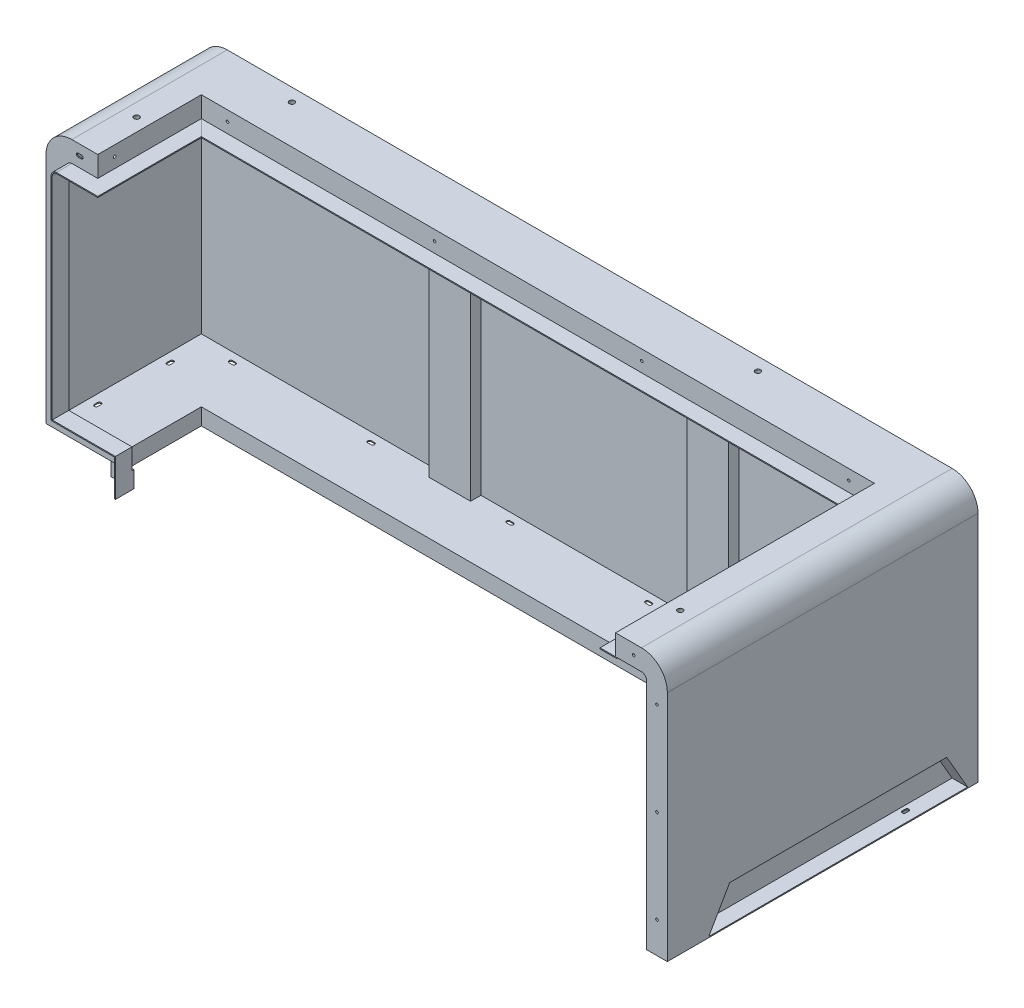
from build123d import *

# Parameters (mm, degrees)
SKETCH_1_W                   = 1500
SKETCH_1_H                   = 300
EXTRUDE_1_DEPTH              = 500
FILLET_1_R                   = 50
CUT_EXTRUDE_1_REACH          = 915.783
CUT_EXTRUDE_2_DEPTH          = 260
SKETCH_6_W                   = 1300
SKETCH_6_H                   = 60
CUT_EXTRUDE_3_DEPTH          = 460
SKETCH_9_W                   = 32
SKETCH_9_H                   = 2
SHELL_START                  = -148
SHELL_1_DEPTH                = 96
SHELL_START_2                = -52
SHELL_1_2_DEPTH              = 100
SHELL_START_3                = 48
SHELL_1_3_DEPTH              = 100
CUT_EXTRUDE_4_DEPTH          = 30
EXTRUDE_START                = -2
SKETCH_17_W                  = 84
SKETCH_17_H                  = 30
EXTRUDE_2_DEPTH              = 2
EXTRUDE_3_DEPTH              = 2
SKETCH_19_W                  = 2
SKETCH_19_H                  = 72
EXTRUDE_4_DEPTH              = 38
SKETCH_20_W                  = 38
SKETCH_20_H                  = 32
EXTRUDE_5_DEPTH              = 4
SKETCH_21_W                  = 40
SKETCH_21_H                  = 30
CUT_EXTRUDE_5_DEPTH          = 4
EXTRUDE_START_2              = 30
EXTRUDE_6_DEPTH              = 30
EXTRUDE_7_DEPTH              = 2
SKETCH_24_W                  = 4
SKETCH_24_H                  = 32
CUT_EXTRUDE_6_DEPTH          = 32
EXTRUDE_8_DEPTH              = 30
MOVE_START                   = 20
MOVE_FACE_1_DEPTH            = 30
MOVE_START_2                 = 50
MOVE_FACE_1_2_DEPTH          = 400
MOVE_START_3                 = 448
MOVE_FACE_1_3_DEPTH          = 2
MOVE_START_4                 = 420
MOVE_FACE_1_4_DEPTH          = 28
MOVE_START_5                 = 18
MOVE_FACE_1_5_DEPTH          = 400
CUT_EXTRUDE_7_REACH          = 1645.928
EXTRUDE_9_DEPTH              = 30
EXTRUDE_10_DEPTH             = 2
EXTRUDE_11_DEPTH             = 30
EXTRUDE_START_3              = -280
EXTRUDE_12_DEPTH             = 50
SHELL_2_T                    = -2
SKETCH_32_W                  = 2.5
SKETCH_32_H                  = 405
HOLE_WIZARD_M6_1_AT_2_COUNT  = 2
HOLE_WIZARD_M6_1_AT_2_PITCH  = 40
SKETCH_33_R                  = 2.5
EXTRUDE_13_DEPTH             = 4.25
CUT_EXTRUDE_8_DEPTH          = 2
HOLE_WIZARD_M12_1_AT_2_COUNT = 2
HOLE_WIZARD_M12_1_AT_2_PITCH = 900
HOLE_WIZARD_M12_1_AT_3_COUNT = 2
HOLE_WIZARD_M12_1_AT_3_PITCH = 1313.868334347
HOLE_WIZARD_M12_1_AT_4_COUNT = 2
HOLE_WIZARD_M12_1_AT_4_PITCH = 215.058131676
SKETCH_41_W                  = 40
SKETCH_41_H                  = 40
SKETCH_41_R                  = 5.1
EXTRUDE_14_DEPTH             = 10
EXTRUDE_14_2_DEPTH           = 10
EXTRUDE_14_3_DEPTH           = 10
EXTRUDE_14_4_DEPTH           = 10
HOLE_WIZARD_M6_1_2_DEPTH     = 2
HOLE_WIZARD_M6_2_DEPTH       = 2
HOLE_WIZARD_M6_3_AT_2_COUNT  = 2
HOLE_WIZARD_M6_3_AT_2_PITCH  = 75
HOLE_WIZARD_M6_3_AT_3_COUNT  = 2
HOLE_WIZARD_M6_3_AT_3_PITCH  = 244.182308941
HOLE_WIZARD_M6_3_AT_4_COUNT  = 2
HOLE_WIZARD_M6_3_AT_4_PITCH  = 422.40383521
SKETCH_49_R                  = 2.5
EXTRUDE_15_DEPTH             = 4.25
CUT_EXTRUDE_9_DEPTH          = 4.25
HOLE_WIZARD_M6_6_AT_2_COUNT  = 2
HOLE_WIZARD_M6_6_AT_2_PITCH  = 400
HOLE_WIZARD_M6_6_AT_3_COUNT  = 2
HOLE_WIZARD_M6_6_AT_3_PITCH  = 800
HOLE_WIZARD_M6_6_AT_4_COUNT  = 2
HOLE_WIZARD_M6_6_AT_4_PITCH  = 1200
SKETCH_57_R                  = 2.5
EXTRUDE_16_DEPTH             = 4.25
SKETCH_58_R                  = 2.5
EXTRUDE_17_DEPTH             = 4.25
SKETCH_59_R                  = 2.5
EXTRUDE_18_DEPTH             = 4.25


# Read off the part's stored shape, not the designer's step: 抽壳1, 移动面1, M6 间隙槽口1, M6 间隙槽口2
with BuildPart() as part:
    # 草图1 → 凸台-拉伸1 (new body)
    with BuildSketch(Plane(origin=(0, 0, 0), x_dir=(1, 0, 0), z_dir=(0, 1, 0))):
        Rectangle(SKETCH_1_W, SKETCH_1_H)
    extrude(amount=EXTRUDE_1_DEPTH)

    # 圆角1
    fillet_1_edges = [part.edges().sort_by_distance(p)[0] for p in [
        (-750, 500, 0),
        (750, 500, 0),
    ]]
    fillet(fillet_1_edges, radius=FILLET_1_R)

    # 切除-拉伸1: up to this face of the body (flat: up to its plane)
    cut_extrude_1_end = Plane(part.part.faces().sort_by_distance((0, 0, 0))[0])
    # 草图3 → 切除-拉伸1 (cut, up to the picked face)
    with BuildSketch(Plane(origin=(0, 500, 0), x_dir=(1, 0, 0), z_dir=(0, 1, 0)), mode=Mode.PRIVATE) as cut_extrude_1_sk1:
        Polygon((-650, -150), (-650, 50), (650, 50), (650, -50), (750, -50), (750, -150), align=None)
    cut_extrude_1_tool1 = split(extrude(cut_extrude_1_sk1.sketch, amount=-CUT_EXTRUDE_1_REACH, mode=Mode.PRIVATE), bisect_by=cut_extrude_1_end, keep=Keep.BOTH, mode=Mode.PRIVATE)
    add(cut_extrude_1_tool1.solids().sort_by(Axis((25.925926, 500, 51.851852), (0, -1, 0)))[0], mode=Mode.SUBTRACT)

    # 草图5 → 切除-拉伸2 (cut)
    with BuildSketch(Plane.XY.offset(150)):
        with BuildLine():
            Line((-650, 0), (-650, 460))
            Line((-650, 460), (-700, 460))
            ThreePointArc((-700, 460), (-707.071067812, 457.071067812), (-710, 450))
            Line((-710, 450), (-710, 0))
            Line((-710, 0), (-650, 0))
        make_face()
        with BuildLine():
            Line((650, 460), (650, 0))
            Line((650, 0), (710, 0))
            Line((710, 0), (710, 450))
            ThreePointArc((710, 450), (707.071067812, 457.071067812), (700, 460))
            Line((700, 460), (650, 460))
        make_face()
    extrude(amount=-CUT_EXTRUDE_2_DEPTH, mode=Mode.SUBTRACT)

    # 草图6 → 切除-拉伸3 (cut)
    with BuildSketch(Plane.XZ):
        with Locations((0, -80)):
            Rectangle(SKETCH_6_W, SKETCH_6_H)
    extrude(amount=-CUT_EXTRUDE_3_DEPTH, mode=Mode.SUBTRACT)

    # 扫描1: sweep along a path in 草图8
    with BuildLine(Plane.XZ) as sweep_1_path:
        Line((-710, 150), (-710, -110))
        Line((-710, -110), (710, -110))
        Line((710, -110), (710, 50))
    # 草图7 → 扫描1 (sweep)
    with BuildSketch(Plane.XY.offset(50)):
        Polygon((710, 0), (708, 0), (708, -30), (706, -30), (706, 2), (710, 2), align=None)
    sweep(path=sweep_1_path.line, transition=Transition.RIGHT)

    # 扫描2: sweep along a path in 草图10
    with BuildLine(Plane.XZ.offset(-460)) as sweep_2_path:
        Line((-650, 150), (-650, -50))
        Line((-650, -50), (650, -50))
        Line((650, -50), (650, 50))
    # 草图9 → 扫描2 (sweep)
    with BuildSketch(Plane.XY.offset(50)):
        with Locations((636, 459)):
            Rectangle(SKETCH_9_W, SKETCH_9_H)
    sweep(path=sweep_2_path.line, transition=Transition.RIGHT)

    # 抽壳1 outline → 抽壳1 (cut)
    with BuildSketch(Plane.XY.offset(SHELL_START)):
        with BuildLine():
            Line((748, 2), (748, 450))
            ThreePointArc((748, 450), (733.941125497, 483.941125497), (700, 498))
            Line((700, 498), (-700, 498))
            ThreePointArc((-700, 498), (-733.941125497, 483.941125497), (-748, 450))
            Line((-748, 450), (-748, 2))
            Line((-748, 2), (748, 2))
        make_face()
    extrude(amount=SHELL_1_DEPTH, mode=Mode.SUBTRACT)

    # Shell 1 2 outline → Shell 1 2 (cut)
    with BuildSketch(Plane.XY.offset(SHELL_START_2)):
        with BuildLine():
            Line((710, 2), (748, 2))
            Line((748, 2), (748, 450))
            ThreePointArc((748, 450), (733.941125497, 483.941125497), (700, 498))
            Line((700, 498), (652, 498))
            Line((652, 498), (652, 460))
            Line((652, 460), (700, 460))
            ThreePointArc((700, 460), (707.071067812, 457.071067812), (710, 450))
            Line((710, 450), (710, 2))
        make_face()
        with BuildLine():
            Line((-748, 2), (-710, 2))
            Line((-710, 2), (-710, 450))
            ThreePointArc((-710, 450), (-707.071067812, 457.071067812), (-700, 460))
            Line((-700, 460), (-652, 460))
            Line((-652, 460), (-652, 498))
            Line((-652, 498), (-700, 498))
            ThreePointArc((-700, 498), (-733.941125497, 483.941125497), (-748, 450))
            Line((-748, 450), (-748, 2))
        make_face()
    extrude(amount=SHELL_1_2_DEPTH, mode=Mode.SUBTRACT)

    # Shell 1 3 outline → Shell 1 3 (cut)
    with BuildSketch(Plane.XY.offset(SHELL_START_3)):
        with BuildLine():
            Line((-748, 2), (-710, 2))
            Line((-710, 2), (-710, 450))
            ThreePointArc((-710, 450), (-707.071067812, 457.071067812), (-700, 460))
            Line((-700, 460), (-652, 460))
            Line((-652, 460), (-652, 498))
            Line((-652, 498), (-700, 498))
            ThreePointArc((-700, 498), (-733.941125497, 483.941125497), (-748, 450))
            Line((-748, 450), (-748, 2))
        make_face()
    extrude(amount=SHELL_1_3_DEPTH, mode=Mode.SUBTRACT)

    # 扫描3: sweep along a path in 草图14
    with BuildLine(Plane(origin=(0, 2, 0), x_dir=(1, 0, 0), z_dir=(0, 1, 0))) as sweep_3_path:
        Line((550, 106), (-706, 106))
        Line((-706, 106), (-706, -150))
    # 草图12 → 扫描3 (sweep)
    with BuildSketch(Plane.XY.offset(150)):
        Polygon((-706, 0), (-628, 0), (-628, -30), (-626, -30), (-626, 2), (-706, 2), align=None)
    sweep(path=sweep_3_path.line, transition=Transition.RIGHT)

    # 草图15 → 切除-拉伸4 (cut)
    with BuildSketch(Plane.XZ.offset(30)):
        Polygon((-750, 150), (-750, -150), (750, -150), (750, -28), (-628, -28), (-628, 150), align=None)
    extrude(amount=-CUT_EXTRUDE_4_DEPTH, mode=Mode.SUBTRACT)

    # 草图17 → 凸台-拉伸2 (add)
    with BuildSketch(Plane.XY.offset(150).offset(EXTRUDE_START)):
        with Locations((-668, 17)):
            Rectangle(SKETCH_17_W, SKETCH_17_H)
    extrude(amount=EXTRUDE_2_DEPTH)

    # 草图18 → 凸台-拉伸3 (add)
    with BuildSketch(Plane.XY.offset(150)):
        with BuildLine():
            Line((-700, 500), (-650, 500))
            Line((-650, 500), (-650, 458))
            Line((-650, 458), (-700, 458))
            ThreePointArc((-700, 458), (-705.656854249, 455.656854249), (-708, 450))
            Line((-708, 450), (-708, 42))
            Line((-708, 42), (-626, 42))
            Line((-626, 42), (-626, 0))
            Line((-626, 0), (-750, 0))
            Line((-750, 0), (-750, 450))
            ThreePointArc((-750, 450), (-735.355339059, 485.355339059), (-700, 500))
        make_face()
    extrude(amount=-EXTRUDE_3_DEPTH)

    # 草图19 → 凸台-拉伸4 (add)
    with BuildSketch(Plane(origin=(-626, 0, 0), x_dir=(0, 0, -1), z_dir=(1, 0, 0))):
        with Locations((-149, 6)):
            Rectangle(SKETCH_19_W, SKETCH_19_H)
    extrude(amount=EXTRUDE_4_DEPTH)

    # 草图20 → 凸台-拉伸5 (add)
    with BuildSketch(Plane(origin=(0, 0, 148), x_dir=(-1, 0, 0), z_dir=(0, 0, -1))):
        with Locations((607, -14)):
            Rectangle(SKETCH_20_W, SKETCH_20_H)
    extrude(amount=EXTRUDE_5_DEPTH)

    # 草图21 → 切除-拉伸5 (cut)
    with BuildSketch(Plane.XY.offset(150)):
        with Locations((-608, -15)):
            Rectangle(SKETCH_21_W, SKETCH_21_H)
    extrude(amount=-CUT_EXTRUDE_5_DEPTH, mode=Mode.SUBTRACT)

    # 草图22 → 凸台-拉伸6 (add)
    with BuildSketch(Plane.XY.offset(150).offset(EXTRUDE_START_2)):
        with BuildLine():
            Line((-588, 42), (-708, 42))
            Line((-708, 42), (-708, 450))
            ThreePointArc((-708, 450), (-705.656854249, 455.656854249), (-700, 458))
            Line((-700, 458), (-620, 458))
            Line((-620, 458), (-620, 460))
            Line((-620, 460), (-700, 460))
            ThreePointArc((-700, 460), (-707.071067812, 457.071067812), (-710, 450))
            Line((-710, 450), (-710, 40))
            Line((-710, 40), (-588, 40))
            Line((-588, 40), (-588, 42))
        make_face()
    extrude(amount=-EXTRUDE_6_DEPTH)

    # 草图23 → 凸台-拉伸7 (add)
    with BuildSketch(Plane(origin=(-588, 0, 0), x_dir=(0, 0, -1), z_dir=(1, 0, 0))):
        Polygon((-180, 42), (-180, -30), (-144, -30), (-144, 2), (-148, 2), (-148, 42), align=None)
    extrude(amount=EXTRUDE_7_DEPTH)

    # 草图24 → 切除-拉伸6 (cut)
    with BuildSketch(Plane.XY.offset(50)):
        with Locations((708, -14)):
            Rectangle(SKETCH_24_W, SKETCH_24_H)
    extrude(amount=-CUT_EXTRUDE_6_DEPTH, mode=Mode.SUBTRACT)

    # 草图25 → 凸台-拉伸8 (add)
    with BuildSketch(Plane.XY.offset(50)):
        with BuildLine():
            Line((710, 450), (710, 0))
            Line((710, 0), (712, 0))
            Line((712, 0), (712, 450))
            ThreePointArc((712, 450), (708.485281374, 458.485281374), (700, 462))
            Line((700, 462), (652, 462))
            Line((652, 462), (652, 460))
            Line((652, 460), (700, 460))
            ThreePointArc((700, 460), (707.071067812, 457.071067812), (710, 450))
        make_face()
    extrude(amount=-EXTRUDE_8_DEPTH)

    # Move Face 1 outline → Move Face 1 (cut)
    with BuildSketch(Plane.XY.offset(MOVE_START)):
        with BuildLine():
            Line((710, 450), (710, 2))
            Line((710, 2), (748, 2))
            Line((748, 2), (748, 450))
            ThreePointArc((748, 450), (733.941125497, 483.941125497), (700, 498))
            Line((700, 498), (652, 498))
            Line((652, 498), (652, 460))
            Line((652, 460), (700, 460))
            ThreePointArc((700, 460), (707.071067812, 457.071067812), (710, 450))
        make_face()
    extrude(amount=MOVE_FACE_1_DEPTH, mode=Mode.SUBTRACT)

    # Move Face 1 2 outline → Move Face 1 2 (add)
    with BuildSketch(Plane.XY.offset(MOVE_START_2)):
        with BuildLine():
            Line((710, 2), (710, 0))
            Line((710, 0), (750, 0))
            Line((750, 0), (750, 450))
            ThreePointArc((750, 450), (735.355339059, 485.355339059), (700, 500))
            Line((700, 500), (650, 500))
            Line((650, 500), (650, 460))
            Line((650, 460), (620, 460))
            Line((620, 460), (620, 458))
            Line((620, 458), (652, 458))
            Line((652, 458), (652, 498))
            Line((652, 498), (700, 498))
            ThreePointArc((700, 498), (733.941125497, 483.941125497), (748, 450))
            Line((748, 450), (748, 2))
            Line((748, 2), (710, 2))
        make_face()
    extrude(amount=MOVE_FACE_1_2_DEPTH)

    # Move Face 1 3 outline → Move Face 1 3 (add)
    with BuildSketch(Plane.XY.offset(MOVE_START_3)):
        with BuildLine():
            Line((710, 450), (710, 2))
            Line((710, 2), (748, 2))
            Line((748, 2), (748, 450))
            ThreePointArc((748, 450), (733.941125497, 483.941125497), (700, 498))
            Line((700, 498), (652, 498))
            Line((652, 498), (652, 460))
            Line((652, 460), (700, 460))
            ThreePointArc((700, 460), (707.071067812, 457.071067812), (710, 450))
        make_face()
    extrude(amount=MOVE_FACE_1_3_DEPTH)

    # Move Face 1 4 outline → Move Face 1 4 (add)
    with BuildSketch(Plane.XY.offset(MOVE_START_4)):
        with BuildLine():
            Line((710, 450), (710, 2))
            Line((710, 2), (712, 2))
            Line((712, 2), (712, 450))
            ThreePointArc((712, 450), (708.485281374, 458.485281374), (700, 462))
            Line((700, 462), (652, 462))
            Line((652, 462), (652, 460))
            Line((652, 460), (700, 460))
            ThreePointArc((700, 460), (707.071067812, 457.071067812), (710, 450))
        make_face()
    extrude(amount=MOVE_FACE_1_4_DEPTH)

    # Move Face 1 5 outline → Move Face 1 5 (add)
    with BuildSketch(Plane.XY.offset(MOVE_START_5)):
        Polygon((706, -30), (708, -30), (708, 0), (710, 0), (710, 2), (706, 2), align=None)
    extrude(amount=MOVE_FACE_1_5_DEPTH)

    # 草图26 → 切除-拉伸7 (cut, up to next)
    with BuildSketch(Plane(origin=(750, 0, 0), x_dir=(0, 0, -1), z_dir=(1, 0, 0)), mode=Mode.PRIVATE) as cut_extrude_7_sk1:
        Polygon((-370, 2), (130, 2), (89.585481157, 72), (-329.585481157, 72), align=None)
    cut_extrude_7_tool1 = extrude(cut_extrude_7_sk1.sketch, amount=-CUT_EXTRUDE_7_REACH, mode=Mode.PRIVATE) & part.part
    add(cut_extrude_7_tool1.solids().sort_by_distance((750, 35.97407, 120))[0], mode=Mode.SUBTRACT)

    # 草图27 → 凸台-拉伸9 (add)
    with BuildSketch(Plane(origin=(750, 0, 0), x_dir=(0, 0, -1), z_dir=(1, 0, 0))):
        Polygon((130, 2), (89.585481157, 72), (-329.585481157, 72), (-370, 2), (-372.309401077, 2), (-330.740181695, 74), (90.740181695, 74), (132.309401077, 2), align=None)
    extrude(amount=-EXTRUDE_9_DEPTH)

    # 草图28 → 凸台-拉伸10 (add)
    with BuildSketch(Plane.ZY.offset(-720)):
        Polygon((330.740181695, 74), (372.309401077, 2), (-132.309401077, 2), (-90.740181695, 74), align=None)
    extrude(amount=EXTRUDE_10_DEPTH)

    # 草图29 → 凸台-拉伸11 (add)
    with BuildSketch(Plane.XZ):
        Polygon((550, -26), (550, -106), (706, -106), (706, -28), (708, -28), (708, -108), (548, -108), (548, -26), align=None)
    extrude(amount=EXTRUDE_11_DEPTH)

    # 草图34 → 切除-拉伸8 (cut)
    with BuildSketch(Plane(origin=(0, 74, 0), x_dir=(1, 0, 0), z_dir=(0, 1, 0))):
        with BuildLine():
            Line((738.5, -239), (738.5, -251))
            ThreePointArc((738.5, -251), (735, -254.5), (731.5, -251))
            Line((731.5, -251), (731.5, -239))
            ThreePointArc((731.5, -239), (735, -235.5), (738.5, -239))
        make_face()
        with BuildLine():
            Line((738.5, -1), (738.5, 11))
            ThreePointArc((738.5, 11), (735, 14.5), (731.5, 11))
            Line((731.5, 11), (731.5, -1))
            ThreePointArc((731.5, -1), (735, -4.5), (738.5, -1))
        make_face()
    extrude(amount=-CUT_EXTRUDE_8_DEPTH, mode=Mode.SUBTRACT)

    # 扫描4: sweep along a path in 草图36
    with BuildLine(Plane(origin=(0, 0, 448), x_dir=(-1, 0, 0), z_dir=(0, 0, -1))) as sweep_4_path:
        Line((-652, 498), (-700, 498))
        ThreePointArc((-700, 498), (-733.941125497, 483.941125497), (-748, 450))
        Line((-748, 450), (-748, 74))
    # 草图35 → 扫描4 (sweep)
    with BuildSketch(Plane(origin=(0, 74, 0), x_dir=(1, 0, 0), z_dir=(0, 1, 0))):
        Polygon((748, -20), (728, -20), (728, -100), (748, -100), (748, -98), (730, -98), (730, -22), (748, -22), align=None)
    sweep(path=sweep_4_path.line)

    # 扫描5: sweep along a path in 草图38
    with BuildLine(Plane(origin=(-748, 0, 0), x_dir=(0, 0, -1), z_dir=(1, 0, 0))) as sweep_5_path:
        Line((148, 2), (148, 498))
        Line((148, 498), (52, 498))
    # 草图37 → 扫描5 (sweep)
    with BuildSketch(Plane(origin=(0, 2, 0), x_dir=(1, 0, 0), z_dir=(0, 1, 0))):
        Polygon((210, 148), (210, 128), (290, 128), (290, 148), (288, 148), (288, 130), (212, 130), (212, 148), align=None)
        Polygon((-288, 148), (-288, 128), (-208, 128), (-208, 148), (-210, 148), (-210, 130), (-286, 130), (-286, 148), align=None)
    sweep(path=sweep_5_path.line, transition=Transition.RIGHT)

    # 草图40 → M12 螺纹孔1 (revolve, cut)
    with BuildSketch(Plane(origin=(-550, 500, -125), x_dir=(0, 0, 1), z_dir=(1, 0, 0))):
        Polygon((0, 0), (0, 32.314389157), (5.1, 29.25), (5.1, 0), align=None)
    hole_wizard_m12_1 = revolve(axis=Axis((-550, 506.35, -125), (0, -1, 0)), mode=Mode.SUBTRACT)

    # M12 螺纹孔1 at 2: M12 螺纹孔1 ×2
    with Locations(*[(i * HOLE_WIZARD_M12_1_AT_2_PITCH, 0, 0) for i in range(1, HOLE_WIZARD_M12_1_AT_2_COUNT)]):
        add(hole_wizard_m12_1, mode=Mode.SUBTRACT)

    # M12 螺纹孔1 at 3: M12 螺纹孔1 ×2
    with Locations(*[Vector(0.9323613089501445, 0, 0.36152785449087244) * (i * HOLE_WIZARD_M12_1_AT_3_PITCH) for i in range(1, HOLE_WIZARD_M12_1_AT_3_COUNT)]):
        add(hole_wizard_m12_1, mode=Mode.SUBTRACT)

    # M12 螺纹孔1 at 4: M12 螺纹孔1 ×2
    with Locations(*[Vector(-0.5812381937190964, 0, 0.8137334712067351) * (i * HOLE_WIZARD_M12_1_AT_4_PITCH) for i in range(1, HOLE_WIZARD_M12_1_AT_4_COUNT)]):
        add(hole_wizard_m12_1, mode=Mode.SUBTRACT)

    # Hole Wizard M6 _1 2 outline → Hole Wizard M6 _1 2 (cut)
    with BuildSketch(Plane(origin=(0, 0, 0), x_dir=(1, 0, 0), z_dir=(0, 1, 0))):
        with BuildLine():
            ThreePointArc((-667, 126.5), (-663.5, 130), (-667, 133.5))
            Line((-667, 133.5), (-673, 133.5))
            ThreePointArc((-673, 133.5), (-676.5, 130), (-673, 126.5))
            Line((-673, 126.5), (-667, 126.5))
        make_face()
        with BuildLine():
            ThreePointArc((-405, 133.5), (-408.5, 130), (-405, 126.5))
            Line((-405, 126.5), (-399, 126.5))
            ThreePointArc((-399, 126.5), (-395.5, 130), (-399, 133.5))
            Line((-399, 133.5), (-405, 133.5))
        make_face()
        with BuildLine():
            ThreePointArc((-137, 133.5), (-140.5, 130), (-137, 126.5))
            Line((-137, 126.5), (-131, 126.5))
            ThreePointArc((-131, 126.5), (-127.5, 130), (-131, 133.5))
            Line((-131, 133.5), (-137, 133.5))
        make_face()
        with BuildLine():
            ThreePointArc((131, 133.5), (127.5, 130), (131, 126.5))
            Line((131, 126.5), (137, 126.5))
            ThreePointArc((137, 126.5), (140.5, 130), (137, 133.5))
            Line((137, 133.5), (131, 133.5))
        make_face()
        with BuildLine():
            ThreePointArc((399, 133.5), (395.5, 130), (399, 126.5))
            Line((399, 126.5), (405, 126.5))
            ThreePointArc((405, 126.5), (408.5, 130), (405, 133.5))
            Line((405, 133.5), (399, 133.5))
        make_face()
        with BuildLine():
            ThreePointArc((667, 133.5), (663.5, 130), (667, 126.5))
            Line((667, 126.5), (673, 126.5))
            ThreePointArc((673, 126.5), (676.5, 130), (673, 133.5))
            Line((673, 133.5), (667, 133.5))
        make_face()
    extrude(amount=HOLE_WIZARD_M6_1_2_DEPTH, mode=Mode.SUBTRACT)

    # M6 间隙槽口2 outline → M6 间隙槽口2 (cut)
    with BuildSketch(Plane(origin=(0, 0, 0), x_dir=(1, 0, 0), z_dir=(0, 1, 0))):
        with BuildLine():
            ThreePointArc((-726.5, -67), (-730, -63.5), (-733.5, -67))
            Line((-733.5, -67), (-733.5, -73))
            ThreePointArc((-733.5, -73), (-730, -76.5), (-726.5, -73))
            Line((-726.5, -73), (-726.5, -67))
        make_face()
        with BuildLine():
            Line((-726.5, 67), (-726.5, 73))
            ThreePointArc((-726.5, 73), (-730, 76.5), (-733.5, 73))
            Line((-733.5, 73), (-733.5, 67))
            ThreePointArc((-733.5, 67), (-730, 63.5), (-726.5, 67))
        make_face()
        with BuildLine():
            ThreePointArc((733.5, -387), (730, -383.5), (726.5, -387))
            Line((726.5, -387), (726.5, -393))
            ThreePointArc((726.5, -393), (730, -396.5), (733.5, -393))
            Line((733.5, -393), (733.5, -387))
        make_face()
        with BuildLine():
            Line((733.5, 27), (733.5, 33))
            ThreePointArc((733.5, 33), (730, 36.5), (726.5, 33))
            Line((726.5, 33), (726.5, 27))
            ThreePointArc((726.5, 27), (730, 23.5), (733.5, 27))
        make_face()
    extrude(amount=HOLE_WIZARD_M6_2_DEPTH, mode=Mode.SUBTRACT)

    # 草图48 → M6 螺纹孔3 (revolve, cut)
    with BuildSketch(Plane(origin=(685, 480, 450), x_dir=(0, -1, 0), z_dir=(1, 0, 0))):
        Polygon((0, 0), (0, 16.502151548), (2.5, 15), (2.5, 0), align=None)
    hole_wizard_m6_3 = revolve(axis=Axis((685, 480, 456.35), (0, 0, -1)), mode=Mode.SUBTRACT)

    # M6 螺纹孔3 at 2: M6 螺纹孔3 ×2
    with Locations(*[Vector(0.5999999999999991, -0.8000000000000007, 0) * (i * HOLE_WIZARD_M6_3_AT_2_PITCH) for i in range(1, HOLE_WIZARD_M6_3_AT_2_COUNT)]):
        add(hole_wizard_m6_3, mode=Mode.SUBTRACT)

    # M6 螺纹孔3 at 3: M6 螺纹孔3 ×2
    with Locations(*[Vector(0.1842885350501921, -0.9828721869343207, 0) * (i * HOLE_WIZARD_M6_3_AT_3_PITCH) for i in range(1, HOLE_WIZARD_M6_3_AT_3_COUNT)]):
        add(hole_wizard_m6_3, mode=Mode.SUBTRACT)

    # M6 螺纹孔3 at 4: M6 螺纹孔3 ×2
    with Locations(*[Vector(0.10653312363427377, -0.9943091539198081, 0) * (i * HOLE_WIZARD_M6_3_AT_4_PITCH) for i in range(1, HOLE_WIZARD_M6_3_AT_4_COUNT)]):
        add(hole_wizard_m6_3, mode=Mode.SUBTRACT)

    # 草图49 → 凸台-拉伸15 (add)
    # profile 1 of 4: a face of its own
    with BuildSketch(Plane(origin=(0, 0, 448), x_dir=(-1, 0, 0), z_dir=(0, 0, -1))):
        Polygon((-730, 246.350852961), (-735.5, 243.175426481), (-735.5, 236.824573519), (-730, 233.649147039), (-724.5, 236.824573519), (-724.5, 243.175426481), align=None)
        with Locations(Location((-730, 240, 0), (0, 0, 180))):
            Circle(SKETCH_49_R, mode=Mode.SUBTRACT)
    # profile 2 of 4: a face of its own
    with BuildSketch(Plane(origin=(0, 0, 448), x_dir=(-1, 0, 0), z_dir=(0, 0, -1))):
        Polygon((-730, 426.350852961), (-735.5, 423.175426481), (-735.5, 416.824573519), (-730, 413.649147039), (-724.5, 416.824573519), (-724.5, 423.175426481), align=None)
        with Locations(Location((-730, 420, 0), (0, 0, 180))):
            Circle(SKETCH_49_R, mode=Mode.SUBTRACT)
    # profile 3 of 4: a face of its own
    with BuildSketch(Plane(origin=(0, 0, 448), x_dir=(-1, 0, 0), z_dir=(0, 0, -1))):
        Polygon((-685, 486.350852961), (-690.5, 483.175426481), (-690.5, 476.824573519), (-685, 473.649147039), (-679.5, 476.824573519), (-679.5, 483.175426481), align=None)
        with Locations(Location((-685, 480, 0), (0, 0, 180))):
            Circle(SKETCH_49_R, mode=Mode.SUBTRACT)
    # profile 4 of 4: a face of its own
    with BuildSketch(Plane(origin=(0, 0, 448), x_dir=(-1, 0, 0), z_dir=(0, 0, -1))):
        Polygon((-730, 66.350852961), (-735.5, 63.175426481), (-735.5, 56.824573519), (-730, 53.649147039), (-724.5, 56.824573519), (-724.5, 63.175426481), align=None)
        with Locations(Location((-730, 60, 0), (0, 0, 180))):
            Circle(SKETCH_49_R, mode=Mode.SUBTRACT)
    extrude(amount=EXTRUDE_15_DEPTH)

    # 草图50 → 切除-拉伸9 (cut)
    with BuildSketch(Plane.XY.offset(150)):
        with BuildLine():
            Line((-688, 483.5), (-682, 483.5))
            ThreePointArc((-682, 483.5), (-678.5, 480), (-682, 476.5))
            Line((-682, 476.5), (-688, 476.5))
            ThreePointArc((-688, 476.5), (-691.5, 480), (-688, 483.5))
        make_face()
        with BuildLine():
            Line((-733.5, 417), (-733.5, 423))
            ThreePointArc((-733.5, 423), (-730, 426.5), (-726.5, 423))
            Line((-726.5, 423), (-726.5, 417))
            ThreePointArc((-726.5, 417), (-730, 413.5), (-733.5, 417))
        make_face()
        with BuildLine():
            Line((-733.5, 237), (-733.5, 243))
            ThreePointArc((-733.5, 243), (-730, 246.5), (-726.5, 243))
            Line((-726.5, 243), (-726.5, 237))
            ThreePointArc((-726.5, 237), (-730, 233.5), (-733.5, 237))
        make_face()
        with BuildLine():
            Line((-733.5, 57), (-733.5, 63))
            ThreePointArc((-733.5, 63), (-730, 66.5), (-726.5, 63))
            Line((-726.5, 63), (-726.5, 57))
            ThreePointArc((-726.5, 57), (-730, 53.5), (-733.5, 57))
        make_face()
        with BuildLine():
            Line((-653, 23.5), (-647, 23.5))
            ThreePointArc((-647, 23.5), (-643.5, 20), (-647, 16.5))
            Line((-647, 16.5), (-653, 16.5))
            ThreePointArc((-653, 16.5), (-656.5, 20), (-653, 23.5))
        make_face()
    extrude(amount=-CUT_EXTRUDE_9_DEPTH, mode=Mode.SUBTRACT)

    # 草图52 → M6 螺纹孔4 (revolve, cut)
    with BuildSketch(Plane(origin=(650, 480, 117.5), x_dir=(0, 0, 1), z_dir=(0, 1, 0))):
        Polygon((0, 0), (0, 16.502151548), (2.5, 15), (2.5, 0), align=None)
    revolve(axis=Axis((643.65, 480, 117.5), (1, 0, 0)), mode=Mode.SUBTRACT)

    # 草图54 → M6 螺纹孔5 (revolve, cut)
    with BuildSketch(Plane(origin=(-650, 480, 117.5), x_dir=(0, 0, -1), z_dir=(0, 1, 0))):
        Polygon((0, 0), (0, 16.502151548), (2.5, 15), (2.5, 0), align=None)
    revolve(axis=Axis((-643.65, 480, 117.5), (-1, 0, 0)), mode=Mode.SUBTRACT)

    # 草图56 → M6 螺纹孔6 (revolve, cut)
    with BuildSketch(Plane(origin=(-599.5, 480, -50), x_dir=(0, -1, 0), z_dir=(1, 0, 0))):
        Polygon((0, 0), (0, 16.502151548), (2.5, 15), (2.5, 0), align=None)
    hole_wizard_m6_6 = revolve(axis=Axis((-599.5, 480, -43.65), (0, 0, -1)), mode=Mode.SUBTRACT)

    # M6 螺纹孔6 at 2: M6 螺纹孔6 ×2
    with Locations(*[(i * HOLE_WIZARD_M6_6_AT_2_PITCH, 0, 0) for i in range(1, HOLE_WIZARD_M6_6_AT_2_COUNT)]):
        add(hole_wizard_m6_6, mode=Mode.SUBTRACT)

    # M6 螺纹孔6 at 3: M6 螺纹孔6 ×2
    with Locations(*[(i * HOLE_WIZARD_M6_6_AT_3_PITCH, 0, 0) for i in range(1, HOLE_WIZARD_M6_6_AT_3_COUNT)]):
        add(hole_wizard_m6_6, mode=Mode.SUBTRACT)

    # M6 螺纹孔6 at 4: M6 螺纹孔6 ×2
    with Locations(*[(i * HOLE_WIZARD_M6_6_AT_4_PITCH, 0, 0) for i in range(1, HOLE_WIZARD_M6_6_AT_4_COUNT)]):
        add(hole_wizard_m6_6, mode=Mode.SUBTRACT)

    # 草图57 → 凸台-拉伸16 (add)
    with BuildSketch(Plane(origin=(652, 0, 0), x_dir=(0, 0, -1), z_dir=(1, 0, 0))):
        Polygon((-117.5, 486.350852961), (-123, 483.175426481), (-123, 476.824573519), (-117.5, 473.649147039), (-112, 476.824573519), (-112, 483.175426481), align=None)
        with Locations(Location((-117.5, 480, 0), (0, 0, 180))):
            Circle(SKETCH_57_R, mode=Mode.SUBTRACT)
    extrude(amount=EXTRUDE_16_DEPTH)

    # 草图58 → 凸台-拉伸17 (add)
    with BuildSketch(Plane.ZY.offset(652)):
        Polygon((117.5, 486.350852961), (112, 483.175426481), (112, 476.824573519), (117.5, 473.649147039), (123, 476.824573519), (123, 483.175426481), align=None)
        with Locations((117.5, 480)):
            Circle(SKETCH_58_R, mode=Mode.SUBTRACT)
    extrude(amount=EXTRUDE_17_DEPTH)

    # 草图59 → 凸台-拉伸18 (add)
    # profile 1 of 4: a face of its own
    with BuildSketch(Plane(origin=(0, 0, -52), x_dir=(-1, 0, 0), z_dir=(0, 0, -1))):
        Polygon((199.5, 486.350852961), (194, 483.175426481), (194, 476.824573519), (199.5, 473.649147039), (205, 476.824573519), (205, 483.175426481), align=None)
        with Locations(Location((199.5, 480, 0), (0, 0, 180))):
            Circle(SKETCH_59_R, mode=Mode.SUBTRACT)
    # profile 2 of 4: a face of its own
    with BuildSketch(Plane(origin=(0, 0, -52), x_dir=(-1, 0, 0), z_dir=(0, 0, -1))):
        Polygon((599.5, 486.350852961), (594, 483.175426481), (594, 476.824573519), (599.5, 473.649147039), (605, 476.824573519), (605, 483.175426481), align=None)
        with Locations(Location((599.5, 480, 0), (0, 0, 180))):
            Circle(SKETCH_59_R, mode=Mode.SUBTRACT)
    # profile 3 of 4: a face of its own
    with BuildSketch(Plane(origin=(0, 0, -52), x_dir=(-1, 0, 0), z_dir=(0, 0, -1))):
        Polygon((-200.5, 486.350852961), (-206, 483.175426481), (-206, 476.824573519), (-200.5, 473.649147039), (-195, 476.824573519), (-195, 483.175426481), align=None)
        with Locations(Location((-200.5, 480, 0), (0, 0, 180))):
            Circle(SKETCH_59_R, mode=Mode.SUBTRACT)
    # profile 4 of 4: a face of its own
    with BuildSketch(Plane(origin=(0, 0, -52), x_dir=(-1, 0, 0), z_dir=(0, 0, -1))):
        Polygon((-600.5, 486.350852961), (-606, 483.175426481), (-606, 476.824573519), (-600.5, 473.649147039), (-595, 476.824573519), (-595, 483.175426481), align=None)
        with Locations(Location((-600.5, 480, 0), (0, 0, 180))):
            Circle(SKETCH_59_R, mode=Mode.SUBTRACT)
    extrude(amount=EXTRUDE_18_DEPTH)


with BuildPart() as body_2:
    # 草图30 → 凸台-拉伸12 (new body)
    with BuildSketch(Plane.XY.offset(450).offset(EXTRUDE_START_3)):
        Polygon((748, 245), (748, 95), (623, 95), (623, 115), (723, 245), align=None)
    extrude(amount=-EXTRUDE_12_DEPTH)

    # 抽壳2
    shell_2_openings = [body_2.faces().sort_by_distance(p)[0] for p in [
        (623, 105, 145),
        (673, 180, 145),
        (735.5, 245, 145),
    ]]
    offset(amount=SHELL_2_T, openings=shell_2_openings, kind=Kind.INTERSECTION)

    # 草图32 → Hole Wizard M6 _1 (revolve, cut)
    with BuildSketch(Plane(origin=(682.5, 95, 145), x_dir=(0, 0, -1), z_dir=(1, 0, 0))):
        with Locations((1.25, 202.5)):
            Rectangle(SKETCH_32_W, SKETCH_32_H)
    hole_wizard_m6_1 = revolve(axis=Axis((682.5, 88.65, 145), (0, 1, 0)), mode=Mode.SUBTRACT)

    # Hole Wizard M6 _1 at 2: Hole Wizard M6 _1 ×2
    with Locations(*[(-i * HOLE_WIZARD_M6_1_AT_2_PITCH, 0, 0) for i in range(1, HOLE_WIZARD_M6_1_AT_2_COUNT)]):
        add(hole_wizard_m6_1, mode=Mode.SUBTRACT)

    # 草图33 → 凸台-拉伸13 (add)
    # profile 1 of 2: a face of its own
    with BuildSketch(Plane(origin=(0, 97, 0), x_dir=(1, 0, 0), z_dir=(0, 1, 0))):
        Polygon((682.5, -151.350852961), (688, -148.175426481), (688, -141.824573519), (682.5, -138.649147039), (677, -141.824573519), (677, -148.175426481), align=None)
        with Locations(Location((682.5, -145, 0), (0, 0, 90))):
            Circle(SKETCH_33_R, mode=Mode.SUBTRACT)
    # profile 2 of 2: a face of its own
    with BuildSketch(Plane(origin=(0, 97, 0), x_dir=(1, 0, 0), z_dir=(0, 1, 0))):
        Polygon((642.5, -151.350852961), (648, -148.175426481), (648, -141.824573519), (642.5, -138.649147039), (637, -141.824573519), (637, -148.175426481), align=None)
        with Locations(Location((642.5, -145, 0), (0, 0, 90))):
            Circle(SKETCH_33_R, mode=Mode.SUBTRACT)
    extrude(amount=EXTRUDE_13_DEPTH)


with BuildPart() as body_3:
    # 草图41 → 凸台-拉伸14 (new body)
    with BuildSketch(Plane.XZ.offset(-498)):
        with Locations((675, 350)):
            Rectangle(SKETCH_41_W, SKETCH_41_H)
        with Locations(Location((675, 350, 0), (0, 0, 270))):
            Circle(SKETCH_41_R, mode=Mode.SUBTRACT)
    extrude(amount=EXTRUDE_14_DEPTH)


with BuildPart() as body_4:
    # 草图41 → Extrude 14 2 (new body)
    with BuildSketch(Plane.XZ.offset(-498)):
        with Locations((-675, 50)):
            Rectangle(SKETCH_41_W, SKETCH_41_H)
        with Locations(Location((-675, 50, 0), (0, 0, 270))):
            Circle(SKETCH_41_R, mode=Mode.SUBTRACT)
    extrude(amount=EXTRUDE_14_2_DEPTH)


with BuildPart() as body_5:
    # 草图41 → Extrude 14 3 (new body)
    with BuildSketch(Plane.XZ.offset(-498)):
        with Locations((-550, -125)):
            Rectangle(SKETCH_41_W, SKETCH_41_H)
        with Locations(Location((-550, -125, 0), (0, 0, 270))):
            Circle(SKETCH_41_R, mode=Mode.SUBTRACT)
    extrude(amount=EXTRUDE_14_3_DEPTH)


with BuildPart() as body_6:
    # 草图41 → Extrude 14 4 (new body)
    with BuildSketch(Plane.XZ.offset(-498)):
        with Locations((350, -125)):
            Rectangle(SKETCH_41_W, SKETCH_41_H)
        with Locations(Location((350, -125, 0), (0, 0, 270))):
            Circle(SKETCH_41_R, mode=Mode.SUBTRACT)
    extrude(amount=EXTRUDE_14_4_DEPTH)


solid = Compound([part.part, body_2.part, body_3.part, body_4.part, body_5.part, body_6.part])
